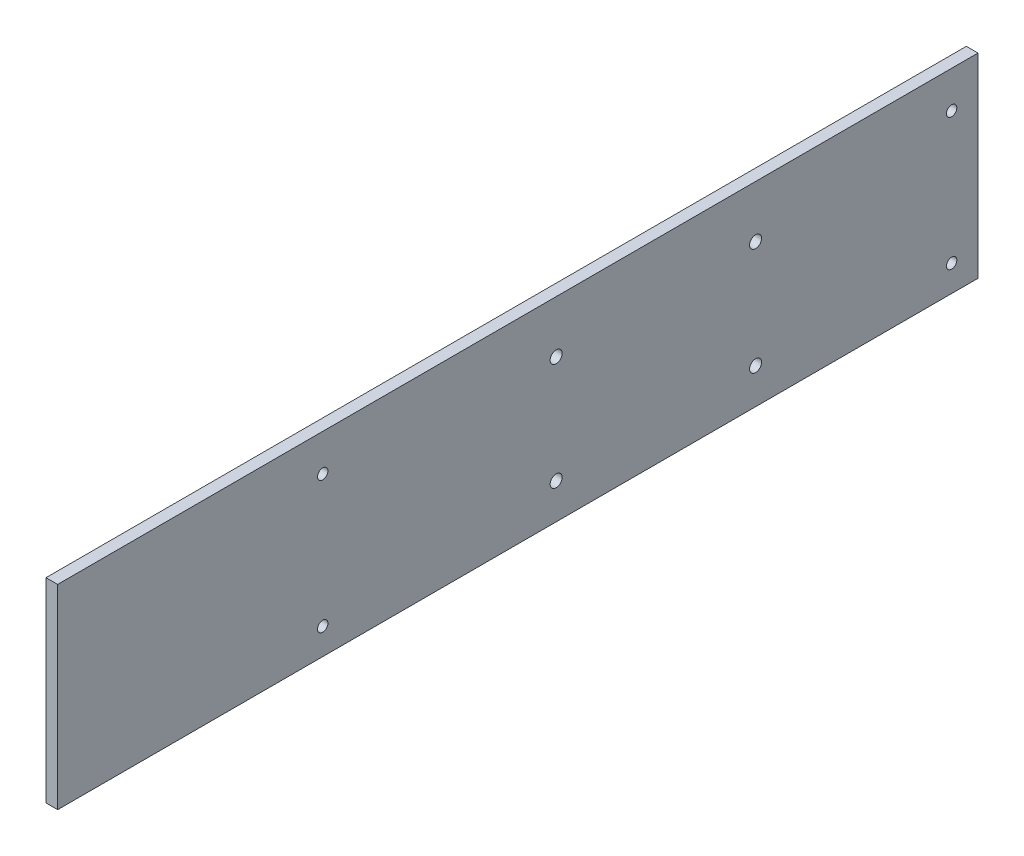
from build123d import *

# Parameters (mm, degrees)
SKETCH1_W                 = 381
SKETCH1_H                 = 76.2
BOSS_EXTRUDE1_DEPTH       = 4.826
F_10_CLEARANCE_HOLE1_D    = 4.9784
F_8_CLEARANCE_HOLE1_D     = 4.3053
F_8_CLEARANCE_HOLE1_DEPTH = 12.7
F_8_CLEARANCE_HOLE1_TIP   = 1.293442612
SKETCH31_W                = 4.826
SKETCH31_H                = 381
BOSS_EXTRUDE10_DEPTH      = 4.572


with BuildPart() as part:
    # Sketch1 → Boss-Extrude1 (new body)
    with BuildSketch(Plane(origin=(0, 0, 0), x_dir=(0, 0, -1), z_dir=(1, 0, 0))):
        Rectangle(SKETCH1_W, SKETCH1_H)
    extrude(amount=BOSS_EXTRUDE1_DEPTH)

    # #10 Clearance Hole1 (through all)
    with Locations(Plane(origin=(4.826, 0, 0), x_dir=(0, 0, -1), z_dir=(1, 0, 0))):
        with Locations((98.425, -27.94), (15.875, -27.94), (15.875, 16.51), (98.425, 16.51)):
            Hole(F_10_CLEARANCE_HOLE1_D / 2)

    # #8 Clearance Hole1
    with Locations(Plane(origin=(4.826, 0, 0), x_dir=(0, 0, -1), z_dir=(1, 0, 0))):
        with Locations((-80.772, 22.86), (-80.772, -31.75), (179.578, -31.75), (179.578, 22.86)):
            Hole(F_8_CLEARANCE_HOLE1_D / 2, depth=F_8_CLEARANCE_HOLE1_DEPTH)
            with Locations((0, 0, -(F_8_CLEARANCE_HOLE1_DEPTH + F_8_CLEARANCE_HOLE1_TIP / 2))):  # 118° drill point
                Cone(0, F_8_CLEARANCE_HOLE1_D / 2, F_8_CLEARANCE_HOLE1_TIP, mode=Mode.SUBTRACT)

    # Sketch31 → Boss-Extrude10 (add)
    with BuildSketch(Plane.XZ.offset(38.1)):
        with Locations((2.413, 0)):
            Rectangle(SKETCH31_W, SKETCH31_H)
    extrude(amount=BOSS_EXTRUDE10_DEPTH)


solid = part.part
